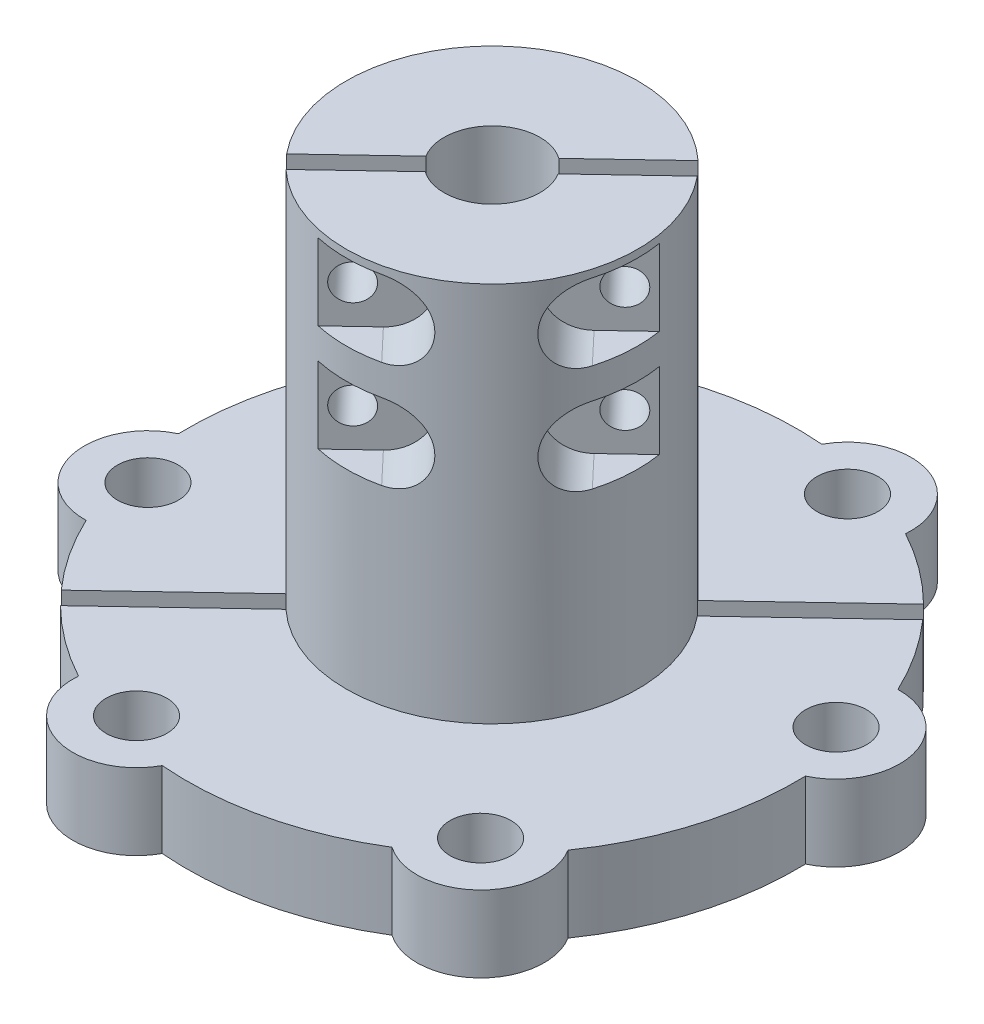
from build123d import *

# Parameters (mm, degrees)
SKETCH1_R                = 29.36875
SKETCH1_R_2              = 4
BOSS_EXTRUDE1_DEPTH      = 6.35
SKETCH3_R                = 12.1539
SKETCH3_R_2              = 4
BOSS_EXTRUDE2_DEPTH      = 31.75
SKETCH4_R                = 51.921805426
CUT_EXTRUDE1_DEPTH       = 53.279149315
SKETCH5_R                = 2.54
CUT_EXTRUDE2_DEPTH       = 52.081402794
SKETCH6_R                = 11.1125
CUT_EXTRUDE3_DEPTH       = 12.7
SLOT_DEPTH               = 56.252667007
SKETCH8_R                = 1.4732
NO4_40_HOLES_DEPTH       = 87.188151596
SKETCH9_R                = 2.413
NO4_40_COUNTERBORE_DEPTH = 30.48
NO4_40_NUT_SLOTS_DEPTH   = 30.48


with BuildPart() as part:
    # Sketch1 → Boss-Extrude1 (new body)
    with BuildSketch(Plane(origin=(0, 0, 0), x_dir=(1, 0, 0), z_dir=(0, 1, 0))):
        Circle(SKETCH1_R)
        Circle(SKETCH1_R_2, mode=Mode.SUBTRACT)
    extrude(amount=BOSS_EXTRUDE1_DEPTH)

    # Sketch3 → Boss-Extrude2 (add)
    with BuildSketch(Plane(origin=(0, 6.35, 0), x_dir=(1, 0, 0), z_dir=(0, 1, 0))):
        Circle(SKETCH3_R)
        Circle(SKETCH3_R_2, mode=Mode.SUBTRACT)
    extrude(amount=BOSS_EXTRUDE2_DEPTH)

    # Sketch4 → Cut-Extrude1 (cut, through all)
    with BuildSketch(Plane(origin=(0, 6.35, 0), x_dir=(1, 0, 0), z_dir=(0, 1, 0))):
        Circle(SKETCH4_R)
        with BuildLine():
            ThreePointArc((25.42076074, 0.709944805), (28.324858383, 6.735804714), (23.019076794, 10.809310883))
            ThreePointArc((23.019076794, 10.809310883), (18.484111888, 17.465872608), (12.0949106, 22.370342774))
            ThreePointArc((12.0949106, 22.370342774), (8.328217656, 27.897294332), (2.14806083, 25.33978952))
            ThreePointArc((2.14806083, 25.33978952), (-5.884518791, 24.740483763), (-13.326739439, 21.659111573))
            ThreePointArc((-13.326739439, 21.659111573), (-19.996545459, 21.160255493), (-20.871481236, 14.529293488))
            ThreePointArc((-20.871481236, 14.529293488), (-24.368348322, 7.273424109), (-25.420701023, -0.712079861))
            ThreePointArc((-25.420701023, -0.712079861), (-28.324292628, -6.738183701), (-23.018168837, -10.811244223))
            ThreePointArc((-23.018168837, -10.811244223), (-18.483144187, -17.466896668), (-12.09431069, -22.370667115))
            ThreePointArc((-12.09431069, -22.370667115), (-8.327541601, -27.899303758), (-2.146612242, -25.339912275))
            ThreePointArc((-2.146612242, -25.339912275), (5.884518724, -24.740483779), (13.325501128, -21.659873451))
            ThreePointArc((13.325501128, -21.659873451), (19.996846315, -21.162354177), (20.871091496, -14.529853337))
            ThreePointArc((20.871091496, -14.529853337), (24.367945291, -7.274774259), (25.42076074, 0.709944805))
        make_face(mode=Mode.SUBTRACT)
    extrude(amount=-CUT_EXTRUDE1_DEPTH, mode=Mode.SUBTRACT)

    # Sketch5 → Cut-Extrude2 (cut, through all)
    with BuildSketch(Plane(origin=(0, 6.35, 0), x_dir=(1, 0, 0), z_dir=(0, 1, 0))):
        with Locations((-23.165997257, -5.511055375)):
            Circle(SKETCH5_R)
        with Locations((-6.811011525, -22.818556609)):
            Circle(SKETCH5_R)
        with Locations((16.355217086, -17.308474104)):
            Circle(SKETCH5_R)
        with Locations((23.166459964, 5.509109636)):
            Circle(SKETCH5_R)
        with Locations((6.811474232, 22.81661087)):
            Circle(SKETCH5_R)
        with Locations((-16.354754378, 17.306528364)):
            Circle(SKETCH5_R)
    extrude(amount=-CUT_EXTRUDE2_DEPTH, mode=Mode.SUBTRACT)

    # Sketch6 → Cut-Extrude3 (cut)
    with BuildSketch(Plane.XZ):
        with Locations((-8.2e-08, 1.9e-08)):
            Circle(SKETCH6_R)
    extrude(amount=-CUT_EXTRUDE3_DEPTH, mode=Mode.SUBTRACT)

    # Sketch7 → Slot (cut, through all)
    with BuildSketch(Plane.XZ):
        with BuildLine():
            Line((-23.884082698, 21.478515658), (22.794718016, -22.631325011))
            ThreePointArc((22.794718016, -22.631325011), (23.347000893, -22.061133029), (23.885025086, -21.477467678))
            Line((23.885025086, -21.477467678), (-22.793725002, 22.632325151))
            ThreePointArc((-22.793725002, 22.632325151), (-23.346032897, 22.062157402), (-23.884082698, 21.478515658))
        make_face()
    extrude(amount=-SLOT_DEPTH, mode=Mode.SUBTRACT)


with BuildPart() as slot_piece_1:
    # of the separate pieces the step leaves, piece 1, a body of its own (slot_pieces)
    add(part.part.solids().sort_by_distance((-20.871481236, 0, -14.529293488))[0])


with BuildPart() as slot_piece_2:
    # of the separate pieces the step leaves, piece 2, a body of its own (slot_pieces)
    add(part.part.solids().sort_by_distance((-7.5105167, 0, 8.19022568))[0])


with BuildPart() as no4_40_holes_tool:
    # Sketch8 → No4-40 Holes (new, through all)
    with BuildSketch(Plane(origin=(-25.622327145, 0, -27.114573176), x_dir=(-0.7268241971892798, 0, 0.6868235482131921), z_dir=(-0.6868235482131921, 0, -0.7268241971892798))):
        with Locations((8.02410922, 34.29)):
            Circle(SKETCH8_R)
        with Locations((8.02410922, 25.4)):
            Circle(SKETCH8_R)
        with Locations((-8.02410922, 34.29)):
            Circle(SKETCH8_R)
        with Locations((-8.02410922, 25.4)):
            Circle(SKETCH8_R)
    extrude(amount=-NO4_40_HOLES_DEPTH)


with BuildPart() as slot_piece_1_1:
    add(slot_piece_1.part)

    # No4-40 Holes: cut by no4_40_holes_tool
    add(no4_40_holes_tool.part, mode=Mode.SUBTRACT)

    # Sketch9 → No4-40 Counterbore (cut)
    with BuildSketch(Plane(origin=(-25.622327145, 0, -27.114573176), x_dir=(-0.7268241971892798, 0, 0.6868235482131921), z_dir=(-0.6868235482131921, 0, -0.7268241971892798))):
        with Locations((8.02410922, 25.4)):
            Circle(SKETCH9_R)
        with Locations((8.02410922, 34.29)):
            Circle(SKETCH9_R)
        with Locations((-8.02410922, 25.4)):
            Circle(SKETCH9_R)
        with Locations((-8.02410922, 34.29)):
            Circle(SKETCH9_R)
    extrude(amount=-NO4_40_COUNTERBORE_DEPTH, mode=Mode.SUBTRACT)


with BuildPart() as slot_piece_2_1:
    add(slot_piece_2.part)

    # No4-40 Holes: cut by no4_40_holes_tool
    add(no4_40_holes_tool.part, mode=Mode.SUBTRACT)

    # Sketch10 → No4-40 Nut Slots (cut)
    with BuildSketch(Plane(origin=(25.623294846, 0, 27.115597236), x_dir=(0.7268241971892797, 0, -0.6868235482131922), z_dir=(0.6868235482131922, 0, 0.7268241971892797))):
        with BuildLine():
            Line((6.210112817, 37.465), (22.611534214, 37.465))
            Line((22.611534214, 37.465), (22.611534214, 31.115))
            Line((22.611534214, 31.115), (6.210112817, 31.115))
            ThreePointArc((6.210112817, 31.115), (3.035112817, 34.29), (6.210112817, 37.465))
        make_face()
        with BuildLine():
            Line((6.210112817, 28.575), (22.611534214, 28.575))
            Line((22.611534214, 28.575), (22.611534214, 22.225))
            Line((22.611534214, 22.225), (6.210112817, 22.225))
            ThreePointArc((6.210112817, 22.225), (3.035112817, 25.4), (6.210112817, 28.575))
        make_face()
        with BuildLine():
            Line((-22.611534214, 22.225), (-6.210112817, 22.225))
            ThreePointArc((-6.210112817, 22.225), (-3.035112817, 25.4), (-6.210112817, 28.575))
            Line((-6.210112817, 28.575), (-22.611534214, 28.575))
            Line((-22.611534214, 28.575), (-22.611534214, 22.225))
        make_face()
        with BuildLine():
            Line((-22.611534214, 31.115), (-22.611534214, 37.465))
            Line((-22.611534214, 37.465), (-6.210112817, 37.465))
            ThreePointArc((-6.210112817, 37.465), (-3.035112817, 34.29), (-6.210112817, 31.115))
            Line((-6.210112817, 31.115), (-22.611534214, 31.115))
        make_face()
    extrude(amount=-NO4_40_NUT_SLOTS_DEPTH, mode=Mode.SUBTRACT)


solid = Compound([slot_piece_1_1.part, slot_piece_2_1.part])
